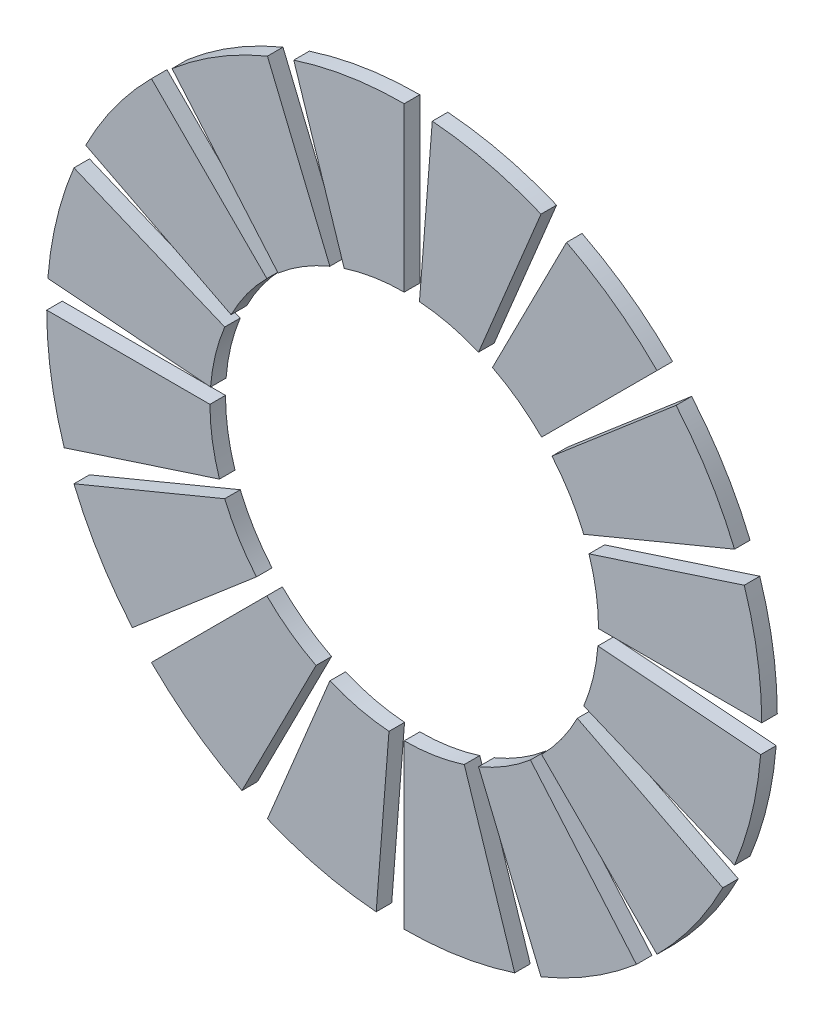
from build123d import *

# Parameters (mm, degrees)
BOSS_EXTRUDE2_DEPTH = 2
CIRPATTERN12_COUNT  = 16


with BuildPart() as part:
    # Sketch2 → Boss-Extrude2 (new body)
    with BuildSketch(Plane.XY):
        with BuildLine():
            Line((25, 0), (46, 0))
            ThreePointArc((46, 0), (45.433663667, 7.195985392), (43.74859975, 14.214781741))
            Line((43.74859975, 14.214781741), (23.776412907, 7.725424859))
            ThreePointArc((23.776412907, 7.725424859), (24.692208515, 3.910861626), (25, 0))
        make_face()
    extrude(amount=BOSS_EXTRUDE2_DEPTH)


with BuildPart() as cirpattern12_1:
    # CirPattern12: pattern copy
    add(part.part.rotate(Axis((0, 0, 2), (0, 0, 1)), 1 * 360 / CIRPATTERN12_COUNT))


with BuildPart() as cirpattern12_2:
    # CirPattern12: pattern copy
    add(part.part.rotate(Axis((0, 0, 2), (0, 0, 1)), 2 * 360 / CIRPATTERN12_COUNT))


with BuildPart() as cirpattern12_3:
    # CirPattern12: pattern copy
    add(part.part.rotate(Axis((0, 0, 2), (0, 0, 1)), 3 * 360 / CIRPATTERN12_COUNT))


with BuildPart() as cirpattern12_4:
    # CirPattern12: pattern copy
    add(part.part.rotate(Axis((0, 0, 2), (0, 0, 1)), 4 * 360 / CIRPATTERN12_COUNT))


with BuildPart() as cirpattern12_5:
    # CirPattern12: pattern copy
    add(part.part.rotate(Axis((0, 0, 2), (0, 0, 1)), 5 * 360 / CIRPATTERN12_COUNT))


with BuildPart() as cirpattern12_6:
    # CirPattern12: pattern copy
    add(part.part.rotate(Axis((0, 0, 2), (0, 0, 1)), 6 * 360 / CIRPATTERN12_COUNT))


with BuildPart() as cirpattern12_7:
    # CirPattern12: pattern copy
    add(part.part.rotate(Axis((0, 0, 2), (0, 0, 1)), 7 * 360 / CIRPATTERN12_COUNT))


with BuildPart() as cirpattern12_8:
    # CirPattern12: pattern copy
    add(part.part.rotate(Axis((0, 0, 2), (0, 0, 1)), 8 * 360 / CIRPATTERN12_COUNT))


with BuildPart() as cirpattern12_9:
    # CirPattern12: pattern copy
    add(part.part.rotate(Axis((0, 0, 2), (0, 0, 1)), 9 * 360 / CIRPATTERN12_COUNT))


with BuildPart() as cirpattern12_10:
    # CirPattern12: pattern copy
    add(part.part.rotate(Axis((0, 0, 2), (0, 0, 1)), 10 * 360 / CIRPATTERN12_COUNT))


with BuildPart() as cirpattern12_11:
    # CirPattern12: pattern copy
    add(part.part.rotate(Axis((0, 0, 2), (0, 0, 1)), 11 * 360 / CIRPATTERN12_COUNT))


with BuildPart() as cirpattern12_12:
    # CirPattern12: pattern copy
    add(part.part.rotate(Axis((0, 0, 2), (0, 0, 1)), 12 * 360 / CIRPATTERN12_COUNT))


with BuildPart() as cirpattern12_13:
    # CirPattern12: pattern copy
    add(part.part.rotate(Axis((0, 0, 2), (0, 0, 1)), 13 * 360 / CIRPATTERN12_COUNT))


with BuildPart() as cirpattern12_14:
    # CirPattern12: pattern copy
    add(part.part.rotate(Axis((0, 0, 2), (0, 0, 1)), 14 * 360 / CIRPATTERN12_COUNT))


with BuildPart() as cirpattern12_15:
    # CirPattern12: pattern copy
    add(part.part.rotate(Axis((0, 0, 2), (0, 0, 1)), 15 * 360 / CIRPATTERN12_COUNT))


solid = Compound([part.part, cirpattern12_1.part, cirpattern12_2.part, cirpattern12_3.part, cirpattern12_4.part, cirpattern12_5.part, cirpattern12_6.part, cirpattern12_7.part, cirpattern12_8.part, cirpattern12_9.part, cirpattern12_10.part, cirpattern12_11.part, cirpattern12_12.part, cirpattern12_13.part, cirpattern12_14.part, cirpattern12_15.part])
